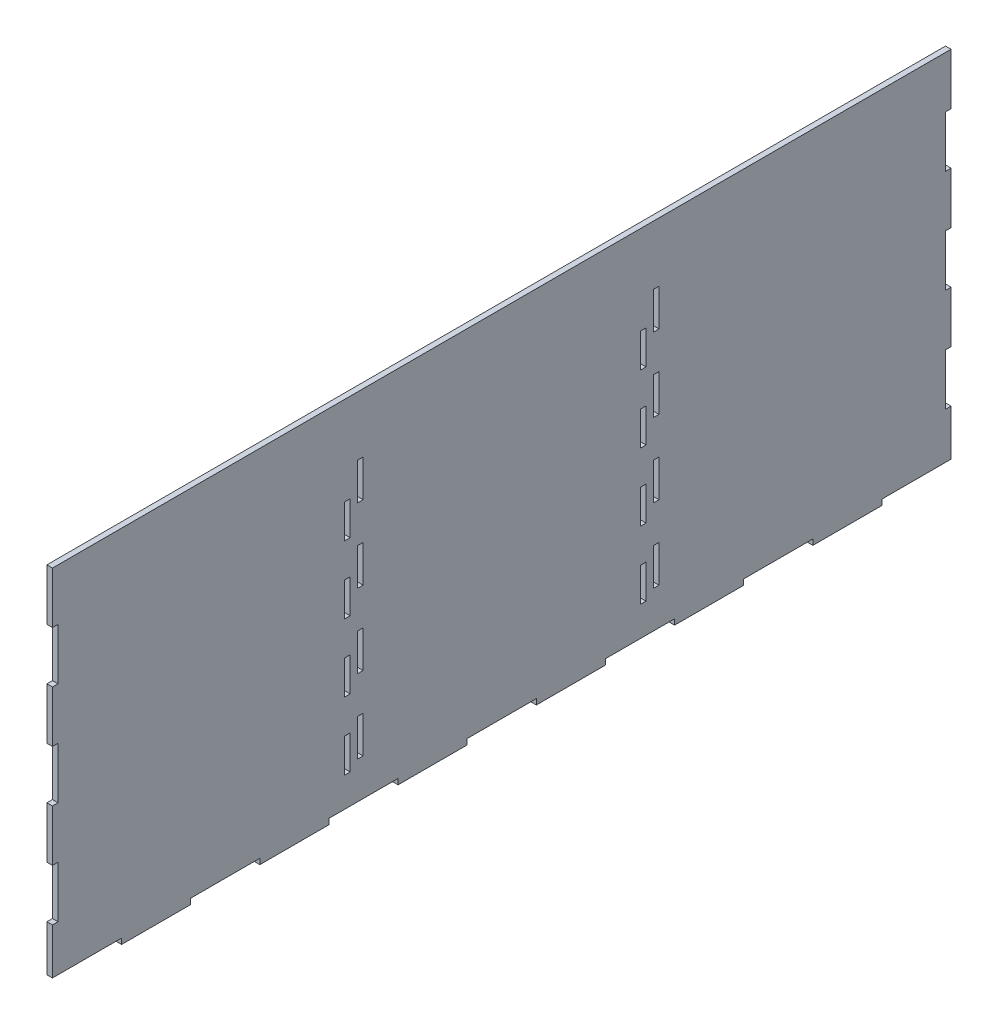
from build123d import *

# Parameters (mm, degrees)
BOSS_EXTRUDE1_DEPTH = 4.7625
SKETCH3_W           = 4.7625
SKETCH3_H           = 29.028571429
SKETCH3_H_2         = 31.75
CUT_EXTRUDE1_DEPTH  = 417.575850499


with BuildPart() as part:
    # Sketch1 → Boss-Extrude1 (new body)
    with BuildSketch(Plane(origin=(0, 0, 0), x_dir=(0, 0, -1), z_dir=(1, 0, 0))):
        Polygon((381, 152.4), (-385.7625, 152.4), (-385.7625, 108.176785714), (-381, 108.176785714), (-381, 63.953571429), (-385.7625, 63.953571429), (-385.7625, 19.730357143), (-381, 19.730357143), (-381, -24.492857143), (-385.7625, -24.492857143), (-385.7625, -68.716071429), (-381, -68.716071429), (-381, -112.939285714), (-385.7625, -112.939285714), (-385.7625, -152.4), (-326.414423077, -152.4), (-326.414423077, -157.1625), (-267.066346154, -157.1625), (-267.066346154, -152.4), (-207.718269231, -152.4), (-207.718269231, -157.1625), (-148.370192308, -157.1625), (-148.370192308, -152.4), (-89.022115385, -152.4), (-89.022115385, -157.1625), (-29.674038462, -157.1625), (-29.674038462, -152.4), (29.674038462, -152.4), (29.674038462, -157.1625), (89.022115385, -157.1625), (89.022115385, -152.4), (148.370192308, -152.4), (148.370192308, -157.1625), (207.718269231, -157.1625), (207.718269231, -152.4), (267.066346154, -152.4), (267.066346154, -157.1625), (326.414423077, -157.1625), (326.414423077, -152.4), (385.7625, -152.4), (385.7625, -112.939285714), (381, -112.939285714), (381, -68.716071429), (385.7625, -68.716071429), (385.7625, -24.492857143), (381, -24.492857143), (381, 19.730357143), (385.7625, 19.730357143), (385.7625, 63.953571429), (381, 63.953571429), (381, 108.176785714), (385.7625, 108.176785714), (385.7625, 152.4), align=None)
    extrude(amount=BOSS_EXTRUDE1_DEPTH)

    # Sketch3 → Cut-Extrude1 (cut, through all)
    with BuildSketch(Plane(origin=(4.7625, 0, 0), x_dir=(0, 0, -1), z_dir=(1, 0, 0))):
        with Locations((-132.55625, 61.685714285)):
            Rectangle(SKETCH3_W, SKETCH3_H)
        with Locations((-132.55625, 3.628571428)):
            Rectangle(SKETCH3_W, SKETCH3_H)
        with Locations((-132.55625, -54.428571428)):
            Rectangle(SKETCH3_W, SKETCH3_H)
        with Locations((-132.55625, -112.485714286)):
            Rectangle(SKETCH3_W, SKETCH3_H)
        with Locations((-121.44375, 85.725)):
            Rectangle(SKETCH3_W, SKETCH3_H_2)
        with Locations((-121.44375, 22.225)):
            Rectangle(SKETCH3_W, SKETCH3_H_2)
        with Locations((-121.44375, -41.275)):
            Rectangle(SKETCH3_W, SKETCH3_H_2)
        with Locations((-121.44375, -104.775)):
            Rectangle(SKETCH3_W, SKETCH3_H_2)
        with Locations((121.44375, 61.685714285)):
            Rectangle(SKETCH3_W, SKETCH3_H)
        with Locations((121.44375, 3.628571428)):
            Rectangle(SKETCH3_W, SKETCH3_H)
        with Locations((121.44375, -54.428571428)):
            Rectangle(SKETCH3_W, SKETCH3_H)
        with Locations((121.44375, -112.485714286)):
            Rectangle(SKETCH3_W, SKETCH3_H)
        with Locations((132.55625, 85.725)):
            Rectangle(SKETCH3_W, SKETCH3_H_2)
        with Locations((132.55625, 22.225)):
            Rectangle(SKETCH3_W, SKETCH3_H_2)
        with Locations((132.55625, -41.275)):
            Rectangle(SKETCH3_W, SKETCH3_H_2)
        with Locations((132.55625, -104.775)):
            Rectangle(SKETCH3_W, SKETCH3_H_2)
    extrude(amount=-CUT_EXTRUDE1_DEPTH, mode=Mode.SUBTRACT)


solid = part.part
